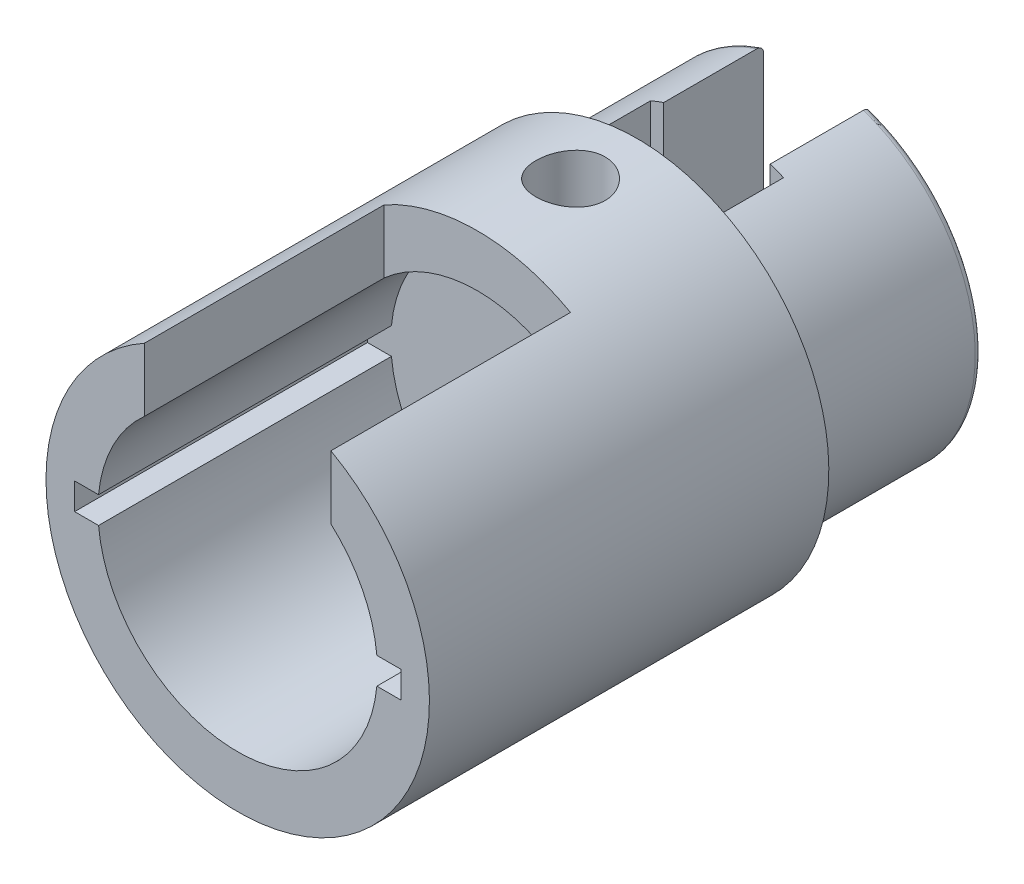
from build123d import *

# Parameters (mm, degrees)
SKETCH1_R                = 12.4
BOSS_EXTRUDE1_DEPTH      = 28
CUT_EXTRUDE1_DEPTH       = 30
SKETCH3_R                = 12.4
SKETCH3_R_2              = 3.2
BOSS_EXTRUDE2_DEPTH      = 6
CUT_EXTRUDE2_DEPTH       = 18
BOSS_EXTRUDE3_START      = 28
SKETCH5_R                = 12.4
BOSS_EXTRUDE3_DEPTH      = 28
SKETCH6_R                = 4.5
CUT_EXTRUDE3_DEPTH       = 26
CUT_EXTRUDE4_DEPTH       = 34.038159755
CUT_EXTRUDE4_DEPTH_BACK  = 34.038159755
SKETCH7_W                = 9
SKETCH7_H                = 6
CUT_EXTRUDE6_DEPTH       = 34.038159755
CUT_EXTRUDE6_DEPTH_BACK  = 34.038159755
SKETCH11_R               = 1.25
SKETCH12_R               = 4.5
SKETCH12_R_2             = 4
BOSS_EXTRUDE5_DEPTH      = 16
SKETCH13_R               = 18
SKETCH13_R_2             = 4.5
BOSS_EXTRUDE6_DEPTH      = 5
CUT_EXTRUDE7_DEPTH       = 12.5
FILLET1_R                = 0.4
CIRPATTERN1_COUNT        = 70
FILLET1_OF_CIRPATTERN1_R = 0.4
CUT_EXTRUDE10_DEPTH      = 38.835617555
CUT_EXTRUDE10_DEPTH_BACK = 38.835617555
SKETCH17_W               = 7.225305648
SKETCH17_H               = 12.5
SKETCH17_W_2             = 24.8
SKETCH17_W_3             = 7.005434177
CUT_EXTRUDE11_DEPTH      = 5
CUT_EXTRUDE12_DEPTH      = 34.038159755
CUT_EXTRUDE12_DEPTH_BACK = 34.038159755
SKETCH19_W               = 0.5
SKETCH19_H               = 6
SKETCH19_W_2             = 9
CUT_EXTRUDE13_REACH      = 48.902
BOSS_EXTRUDE7_START      = -30
BOSS_EXTRUDE7_OUTLINE_R  = 14.4
BOSS_EXTRUDE7_DEPTH      = 30
CUT_EXTRUDE14_START      = -18
CUT_EXTRUDE14_DEPTH      = 18
CUT_EXTRUDE15_DEPTH      = 35.622536013
CUT_EXTRUDE15_DEPTH_BACK = 35.622536013
SKETCH25_R               = 1.25
SKETCH26_R               = 2.6
CUT_EXTRUDE16_DEPTH      = 8.5
CUT_EXTRUDE17_START      = -8.5
SKETCH27_R               = 2.6
CUT_EXTRUDE17_DEPTH      = 8.5
FILLET2_R                = 0.5


# Read off the part's stored shape, not the designer's step: Boss-Extrude7
with BuildPart() as part:
    # Sketch1 → Boss-Extrude1 (new body)
    with BuildSketch(Plane.XY):
        Circle(SKETCH1_R)
    extrude(amount=BOSS_EXTRUDE1_DEPTH)

    # Sketch2 → Cut-Extrude1 (cut)
    with BuildSketch(Plane.XY.offset(28)):
        with BuildLine():
            ThreePointArc((10.45227248, 1), (0, 10.5), (-10.45227248, 1))
            Line((-10.45227248, 1), (-12.25, 1))
            Line((-12.25, 1), (-12.25, -1))
            Line((-12.25, -1), (-10.45227248, -1))
            ThreePointArc((-10.45227248, -1), (0, -10.5), (10.45227248, -1))
            Line((10.45227248, -1), (12.25, -1))
            Line((12.25, -1), (12.25, 1))
            Line((12.25, 1), (10.45227248, 1))
        make_face()
    extrude(amount=-CUT_EXTRUDE1_DEPTH, mode=Mode.SUBTRACT)

    # Sketch3 → Boss-Extrude2 (add)
    with BuildSketch(Plane.XY):
        Circle(SKETCH3_R)
        Circle(SKETCH3_R_2, mode=Mode.SUBTRACT)
    extrude(amount=BOSS_EXTRUDE2_DEPTH)

    # Sketch2<3> → Cut-Extrude2 (cut)
    with BuildSketch(Plane.XY.offset(28)):
        with BuildLine():
            Line((-7, 10.235233266), (-7, 7.826237921))
            ThreePointArc((-7, 7.826237921), (0, 10.5), (7, 7.826237921))
            Line((7, 7.826237921), (7, 10.235233266))
            ThreePointArc((7, 10.235233266), (0, 12.4), (-7, 10.235233266))
        make_face()
    extrude(amount=-CUT_EXTRUDE2_DEPTH, mode=Mode.SUBTRACT)

    # Sketch5 → Boss-Extrude3 (add)
    with BuildSketch(Plane(origin=(0, 0, 0), x_dir=(-1, 0, 0), z_dir=(0, 0, -1)).offset(BOSS_EXTRUDE3_START)):
        Circle(SKETCH5_R)
    extrude(amount=-BOSS_EXTRUDE3_DEPTH)

    # Sketch6 → Cut-Extrude3 (cut)
    with BuildSketch(Plane(origin=(0, 0, -28), x_dir=(-1, 0, 0), z_dir=(0, 0, -1))):
        Circle(SKETCH6_R)
    extrude(amount=-CUT_EXTRUDE3_DEPTH, mode=Mode.SUBTRACT)

    # Sketch7 → Cut-Extrude4 (cut, two sides: drawn at the far end of the back side and taken through both)
    with BuildSketch(Plane(origin=(0, 0, 0), x_dir=(1, 0, 0), z_dir=(0, 1, 0)).offset(-CUT_EXTRUDE4_DEPTH_BACK)):
        with Locations((0, 5)):
            Rectangle(SKETCH7_W, SKETCH7_H)
    extrude(amount=CUT_EXTRUDE4_DEPTH + CUT_EXTRUDE4_DEPTH_BACK, mode=Mode.SUBTRACT)

    # Sketch11 → Cut-Extrude6 (cut, two sides: drawn at the far end of the back side and taken through both)
    with BuildSketch(Plane.XY.offset(-CUT_EXTRUDE6_DEPTH_BACK)):
        with Locations(Location((0, 0, 0), (0, 0, 180))):
            Circle(SKETCH11_R)
    extrude(amount=CUT_EXTRUDE6_DEPTH + CUT_EXTRUDE6_DEPTH_BACK, mode=Mode.SUBTRACT)

    # Sketch12 → Boss-Extrude5 (add)
    with BuildSketch(Plane(origin=(0, 0, -24), x_dir=(-1, 0, 0), z_dir=(0, 0, -1))):
        Circle(SKETCH12_R)
        Circle(SKETCH12_R_2, mode=Mode.SUBTRACT)
    extrude(amount=-BOSS_EXTRUDE5_DEPTH)

    # Sketch13 → Boss-Extrude6 (add)
    with BuildSketch(Plane(origin=(0, 0, -20.5), x_dir=(-1, 0, 0), z_dir=(0, 0, -1))):
        Circle(SKETCH13_R)
        Circle(SKETCH13_R_2, mode=Mode.SUBTRACT)
    extrude(amount=-BOSS_EXTRUDE6_DEPTH)

    # Sketch14 → Cut-Extrude7 (cut)
    with BuildSketch(Plane(origin=(0, 0, -28), x_dir=(-1, 0, 0), z_dir=(0, 0, -1))):
        with BuildLine():
            ThreePointArc((0.682674344, 17.987049667), (0, 18), (-0.682674344, 17.987049667))
            ThreePointArc((-0.682674344, 17.987049667), (-0.50646239, 17.767208638), (-0.435353246, 17.494583949))
            Line((-0.435353246, 17.494583949), (-0.40730691, 16.87008376))
            ThreePointArc((-0.40730691, 16.87008376), (0, 16.875), (0.40730691, 16.87008376))
            Line((0.40730691, 16.87008376), (0.435353246, 17.494583949))
            ThreePointArc((0.435353246, 17.494583949), (0.50646239, 17.767208638), (0.682674344, 17.987049667))
        make_face()
    cut_extrude7 = extrude(amount=-CUT_EXTRUDE7_DEPTH, mode=Mode.SUBTRACT)

    # Fillet1
    fillet1_edges = [part.edges().sort_by_distance(p)[0] for p in [
        (0.40730691, 16.87008376, -18),
        (-0.40730691, 16.87008376, -18),
    ]]
    fillet(fillet1_edges, radius=FILLET1_R)

    # CirPattern1: Cut-Extrude7 ×70 about axis
    cirpattern1_axis = Axis((0, 0, 0), (0, 0, 1))
    for i in range(1, CIRPATTERN1_COUNT):
        add(cut_extrude7.rotate(cirpattern1_axis, i * 360 / CIRPATTERN1_COUNT), mode=Mode.SUBTRACT)

    # Fillet1 of CirPattern1
    fillet1_of_cirpattern1_edges = [part.edges().sort_by_distance(p)[0] for p in [
        (-1.106555437, 16.838680473, -18),
        (-1.917889861, 16.765659053, -18),
        (-2.611508451, 16.671702031, -18),
        (-3.413031091, 16.526247117, -18),
        (-4.095435134, 16.370492847, -18),
        (-4.880692602, 16.153775556, -18),
        (-5.546387781, 15.937478081, -18),
        (-6.309057646, 15.651243293, -18),
        (-6.952684176, 15.376144112, -18),
        (-7.686625867, 15.022696422, -18),
        (-8.303001645, 14.691010472, -18),
        (-9.002305896, 14.273195632, -18),
        (-9.586468227, 13.887593453, -18),
        (-10.245504651, 13.408775464, -18),
        (-10.792750204, 12.972361698, -18),
        (-11.406212627, 12.43639572, -18),
        (-11.912135302, 11.952684114, -18),
        (-12.475084486, 11.36388543, -18),
        (-12.935610891, 10.836770546, -18),
        (-13.4435143, 10.199879816, -18),
        (-13.854936547, 9.633605673, -18),
        (-14.303704842, 8.953750767, -18),
        (-14.662710401, 8.352876672, -18),
        (-15.048730362, 7.635531382, -18),
        (-15.352428732, 7.004895219, -18),
        (-15.672592354, 6.255835188, -18),
        (-15.918538334, 5.600514469, -18),
        (-16.170267848, 4.825770688, -18),
        (-16.356481225, 4.151041669, -18),
        (-16.537749853, 3.356851919, -18),
        (-16.662731347, 2.668147123, -18),
        (-16.77207962, 1.860905753, -18),
        (-16.834822953, 1.163770225, -18),
        (-16.871370464, 0.349976667, -18),
        (-16.871370464, -0.349976667, -18),
        (-16.834822953, -1.163770225, -18),
        (-16.77207962, -1.860905753, -18),
        (-16.662731347, -2.668147123, -18),
        (-16.537749853, -3.356851919, -18),
        (-16.356481225, -4.151041669, -18),
        (-16.170267848, -4.825770688, -18),
        (-15.918538334, -5.600514469, -18),
        (-15.672592354, -6.255835188, -18),
        (-15.352428732, -7.004895219, -18),
        (-15.048730362, -7.635531382, -18),
        (-14.662710401, -8.352876672, -18),
        (-14.303704842, -8.953750767, -18),
        (-13.854936547, -9.633605673, -18),
        (-13.4435143, -10.199879816, -18),
        (-12.935610891, -10.836770546, -18),
        (-12.475084486, -11.36388543, -18),
        (-11.912135302, -11.952684114, -18),
        (-11.406212627, -12.43639572, -18),
        (-10.792750204, -12.972361698, -18),
        (-10.245504651, -13.408775464, -18),
        (-9.586468227, -13.887593453, -18),
        (-9.002305896, -14.273195632, -18),
        (-8.303001645, -14.691010472, -18),
        (-7.686625867, -15.022696422, -18),
        (-6.952684176, -15.376144112, -18),
        (-6.309057646, -15.651243293, -18),
        (-5.546387781, -15.937478081, -18),
        (-4.880692602, -16.153775556, -18),
        (-4.095435134, -16.370492847, -18),
        (-3.413031091, -16.526247117, -18),
        (-2.611508451, -16.671702031, -18),
        (-1.917889861, -16.765659053, -18),
        (-1.106555437, -16.838680473, -18),
        (-0.40730691, -16.87008376, -18),
        (0.40730691, -16.87008376, -18),
        (1.106555437, -16.838680473, -18),
        (1.917889861, -16.765659053, -18),
        (2.611508451, -16.671702031, -18),
        (3.413031091, -16.526247117, -18),
        (4.095435134, -16.370492847, -18),
        (4.880692602, -16.153775556, -18),
        (5.546387781, -15.937478081, -18),
        (6.309057646, -15.651243293, -18),
        (6.952684176, -15.376144112, -18),
        (7.686625867, -15.022696422, -18),
        (8.303001645, -14.691010472, -18),
        (9.002305896, -14.273195632, -18),
        (9.586468227, -13.887593453, -18),
        (10.245504651, -13.408775464, -18),
        (10.792750204, -12.972361698, -18),
        (11.406212627, -12.43639572, -18),
        (11.912135302, -11.952684114, -18),
        (12.475084486, -11.36388543, -18),
        (12.935610891, -10.836770546, -18),
        (13.4435143, -10.199879816, -18),
        (13.854936547, -9.633605673, -18),
        (14.303704842, -8.953750767, -18),
        (14.662710401, -8.352876672, -18),
        (15.048730362, -7.635531382, -18),
        (15.352428732, -7.004895219, -18),
        (15.672592354, -6.255835188, -18),
        (15.918538334, -5.600514469, -18),
        (16.170267848, -4.825770688, -18),
        (16.356481225, -4.151041669, -18),
        (16.537749853, -3.356851919, -18),
        (16.662731347, -2.668147123, -18),
        (16.77207962, -1.860905753, -18),
        (16.834822953, -1.163770225, -18),
        (16.871370464, -0.349976667, -18),
        (16.871370464, 0.349976667, -18),
        (16.834822953, 1.163770225, -18),
        (16.77207962, 1.860905753, -18),
        (16.662731347, 2.668147123, -18),
        (16.537749853, 3.356851919, -18),
        (16.356481225, 4.151041669, -18),
        (16.170267848, 4.825770688, -18),
        (15.918538334, 5.600514469, -18),
        (15.672592354, 6.255835188, -18),
        (15.352428732, 7.004895219, -18),
        (15.048730362, 7.635531382, -18),
        (14.662710401, 8.352876672, -18),
        (14.303704842, 8.953750767, -18),
        (13.854936547, 9.633605673, -18),
        (13.4435143, 10.199879816, -18),
        (12.935610891, 10.836770546, -18),
        (12.475084486, 11.36388543, -18),
        (11.912135302, 11.952684114, -18),
        (11.406212627, 12.43639572, -18),
        (10.792750204, 12.972361698, -18),
        (10.245504651, 13.408775464, -18),
        (9.586468227, 13.887593453, -18),
        (9.002305896, 14.273195632, -18),
        (8.303001645, 14.691010472, -18),
        (7.686625867, 15.022696422, -18),
        (6.952684176, 15.376144112, -18),
        (6.309057646, 15.651243293, -18),
        (5.546387781, 15.937478081, -18),
        (4.880692602, 16.153775556, -18),
        (4.095435134, 16.370492847, -18),
        (3.413031091, 16.526247117, -18),
        (2.611508451, 16.671702031, -18),
        (1.917889861, 16.765659053, -18),
        (1.106555437, 16.838680473, -18),
    ]]
    fillet(fillet1_of_cirpattern1_edges, radius=FILLET1_OF_CIRPATTERN1_R)

    # Sketch17 → Cut-Extrude10 (cut, two sides: drawn at the far end of the back side and taken through both)
    with BuildSketch(Plane(origin=(0, 0, 0), x_dir=(1, 0, 0), z_dir=(0, 1, 0)).offset(-CUT_EXTRUDE10_DEPTH_BACK)):
        with Locations((16.012652824, 21.75)):
            Rectangle(SKETCH17_W, SKETCH17_H)
        with Locations((0, 21.75)):
            Rectangle(SKETCH17_W_2, SKETCH17_H)
        with Locations((-15.902717089, 21.75)):
            Rectangle(SKETCH17_W_3, SKETCH17_H)
    extrude(amount=CUT_EXTRUDE10_DEPTH + CUT_EXTRUDE10_DEPTH_BACK, mode=Mode.SUBTRACT)

    # Sketch18 → Cut-Extrude11 (cut)
    with BuildSketch(Plane(origin=(0, 0, -15.5), x_dir=(-1, 0, 0), z_dir=(0, 0, -1))):
        with BuildLine():
            ThreePointArc((-10.95, 0), (-8.45, -2.5), (-5.95, 0))
            Line((-5.95, 0), (-10.95, 0))
        make_face()
        with BuildLine():
            Line((-10.95, 0), (-5.95, 0))
            ThreePointArc((-5.95, 0), (-8.45, 2.5), (-10.95, 0))
        make_face()
        with BuildLine():
            ThreePointArc((10.95, 0), (8.45, 2.5), (5.95, 0))
            Line((5.95, 0), (10.95, 0))
        make_face()
        with BuildLine():
            Line((10.95, 0), (5.95, 0))
            ThreePointArc((5.95, 0), (8.45, -2.5), (10.95, 0))
        make_face()
    extrude(amount=-CUT_EXTRUDE11_DEPTH, mode=Mode.SUBTRACT)

    # Sketch19 → Cut-Extrude12 (cut, two sides: drawn at the far end of the back side and taken through both)
    with BuildSketch(Plane(origin=(0, 0, 0), x_dir=(1, 0, 0), z_dir=(0, 1, 0)).offset(-CUT_EXTRUDE12_DEPTH_BACK)):
        with Locations((4.75, 5)):
            Rectangle(SKETCH19_W, SKETCH19_H)
        with Locations((0, 5)):
            Rectangle(SKETCH19_W_2, SKETCH19_H)
        with Locations((-4.75, 5)):
            Rectangle(SKETCH19_W, SKETCH19_H)
    extrude(amount=CUT_EXTRUDE12_DEPTH + CUT_EXTRUDE12_DEPTH_BACK, mode=Mode.SUBTRACT)

    # Sketch20 → Cut-Extrude13 (cut, up to next)
    with BuildSketch(Plane(origin=(0, 0, -15.5), x_dir=(-1, 0, 0), z_dir=(0, 0, -1)), mode=Mode.PRIVATE) as cut_extrude13_sk1:
        with BuildLine():
            ThreePointArc((2, -3.464101615), (0, -4), (-2, -3.464101615))
            Line((-2, -3.464101615), (-2, -5))
            Line((-2, -5), (2, -5))
            Line((2, -5), (2, -3.464101615))
        make_face()
    cut_extrude13_tool1 = extrude(cut_extrude13_sk1.sketch, amount=-CUT_EXTRUDE13_REACH, mode=Mode.PRIVATE) & part.part
    # Sketch20 → Cut-Extrude13 (cut, up to next)
    with BuildSketch(Plane(origin=(0, 0, -15.5), x_dir=(-1, 0, 0), z_dir=(0, 0, -1)), mode=Mode.PRIVATE) as cut_extrude13_sk2:
        with BuildLine():
            Line((-2, 3.464101615), (-2, 5))
            Line((-2, 5), (2, 5))
            Line((2, 5), (2, 3.464101615))
            ThreePointArc((2, 3.464101615), (3.464101615, 2), (4, 0))
            Line((4, 0), (4, 11.737120601))
            ThreePointArc((4, 11.737120601), (0, 12.4), (-4, 11.737120601))
            Line((-4, 11.737120601), (-4, 0))
            ThreePointArc((-4, 0), (-3.464101615, 2), (-2, 3.464101615))
        make_face()
    cut_extrude13_tool2 = extrude(cut_extrude13_sk2.sketch, amount=-CUT_EXTRUDE13_REACH, mode=Mode.PRIVATE) & part.part
    # Sketch20 → Cut-Extrude13 (cut, up to next)
    with BuildSketch(Plane(origin=(0, 0, -15.5), x_dir=(-1, 0, 0), z_dir=(0, 0, -1)), mode=Mode.PRIVATE) as cut_extrude13_sk3:
        with BuildLine():
            Line((2, 5), (-2, 5))
            Line((-2, 5), (-2, 3.464101615))
            ThreePointArc((-2, 3.464101615), (0, 4), (2, 3.464101615))
            Line((2, 3.464101615), (2, 5))
        make_face()
    cut_extrude13_tool3 = extrude(cut_extrude13_sk3.sketch, amount=-CUT_EXTRUDE13_REACH, mode=Mode.PRIVATE) & part.part
    add(cut_extrude13_tool1.solids().sort_by_distance((0, -4.402581, -15.5))[0], mode=Mode.SUBTRACT)
    add(cut_extrude13_tool2.solids().sort_by_distance((0, 7.842893, -15.5))[0], mode=Mode.SUBTRACT)
    add(cut_extrude13_tool3.solids().sort_by_distance((0, 4.402581, -15.5))[0], mode=Mode.SUBTRACT)

    # Boss-Extrude7 outline → Boss-Extrude7 (add)
    with BuildSketch(Plane.XY.offset(28).offset(BOSS_EXTRUDE7_START)):
        Circle(BOSS_EXTRUDE7_OUTLINE_R)
        with BuildLine():
            ThreePointArc((-7, 10.235233266), (0, 12.4), (7, 10.235233266))
            ThreePointArc((7, 10.235233266), (0, -12.4), (-7, 10.235233266))
        make_face(mode=Mode.SUBTRACT)
    extrude(amount=BOSS_EXTRUDE7_DEPTH)

    # Sketch24 → Cut-Extrude14 (cut)
    with BuildSketch(Plane.XY.offset(28).offset(CUT_EXTRUDE14_START)):
        with BuildLine():
            ThreePointArc((-7, 10.235233266), (0, 12.4), (7, 10.235233266))
            Line((7, 10.235233266), (7, 12.584116973))
            ThreePointArc((7, 12.584116973), (0, 14.4), (-7, 12.584116973))
            Line((-7, 12.584116973), (-7, 10.235233266))
        make_face()
    extrude(amount=CUT_EXTRUDE14_DEPTH, mode=Mode.SUBTRACT)

    # Sketch25 → Cut-Extrude15 (cut, two sides: drawn at the far end of the back side and taken through both)
    with BuildSketch(Plane(origin=(0, 0, 0), x_dir=(1, 0, 0), z_dir=(0, 1, 0)).offset(-CUT_EXTRUDE15_DEPTH_BACK)):
        with Locations(Location((0, -3, 0), (0, 0, 270))):
            Circle(SKETCH25_R)
    extrude(amount=CUT_EXTRUDE15_DEPTH + CUT_EXTRUDE15_DEPTH_BACK, mode=Mode.SUBTRACT)

    # Sketch26 → Cut-Extrude16 (cut)
    with BuildSketch(Plane(origin=(0, 14.4, 0), x_dir=(1, 0, 0), z_dir=(0, 1, 0))):
        with Locations(Location((0, -3, 0), (0, 0, 270))):
            Circle(SKETCH26_R)
    extrude(amount=-CUT_EXTRUDE16_DEPTH, mode=Mode.SUBTRACT)

    # Sketch27 → Cut-Extrude17 (cut)
    with BuildSketch(Plane(origin=(0, -14.4, 0), x_dir=(-1, 0, 0), z_dir=(0, -1, 0)).offset(CUT_EXTRUDE17_START)):
        with Locations(Location((0, -3, 0), (0, 0, 270))):
            Circle(SKETCH27_R)
    extrude(amount=CUT_EXTRUDE17_DEPTH, mode=Mode.SUBTRACT)

    # Fillet2
    fillet2_edges = [part.edges().sort_by_distance(p)[0] for p in [
        (0, -12.4, -15.5),
    ]]
    fillet(fillet2_edges, radius=FILLET2_R)


solid = part.part
